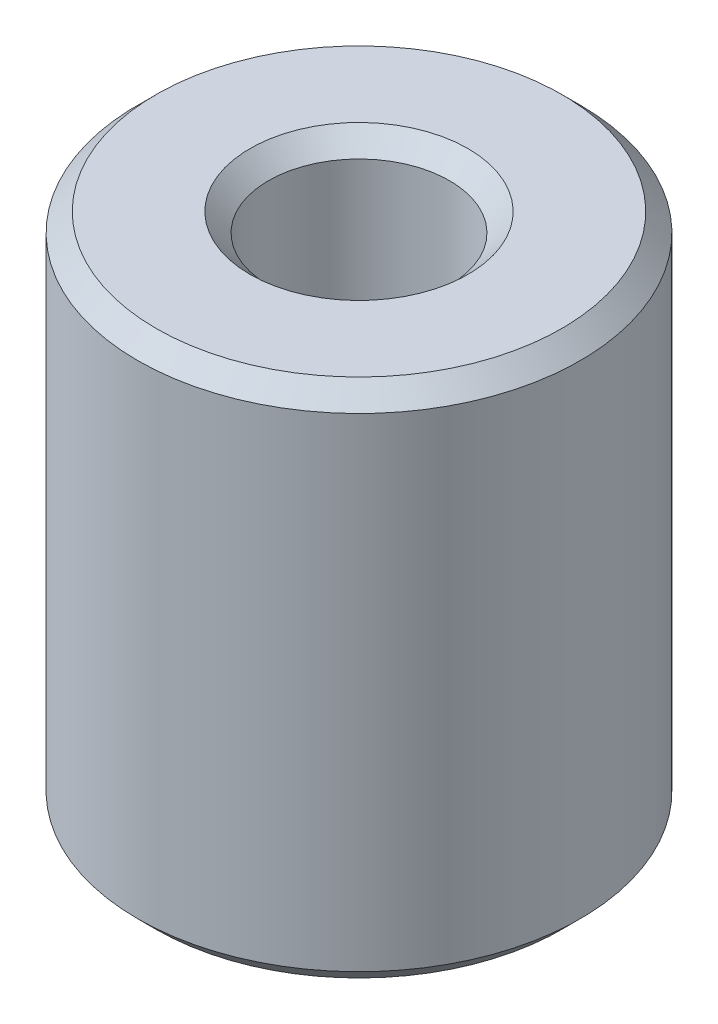
from build123d import *

# Parameters (mm, degrees)
SKETCH1_R           = 37.5
BOSS_EXTRUDE1_DEPTH = 88.202172089
SKETCH2_R           = 15.339657837
CUT_EXTRUDE1_DEPTH  = 103.91804099
CHAMFER1_SIZE       = 3.1371171


with BuildPart() as part:
    # Sketch1 → Boss-Extrude1 (new body)
    with BuildSketch(Plane(origin=(0, 0, 0), x_dir=(1, 0, 0), z_dir=(0, 1, 0))):
        Circle(SKETCH1_R)
    extrude(amount=BOSS_EXTRUDE1_DEPTH)

    # Sketch2 → Cut-Extrude1 (cut, through all)
    with BuildSketch(Plane(origin=(0, 0, 0), x_dir=(1, 0, 0), z_dir=(0, 1, 0))):
        Circle(SKETCH2_R)
    extrude(amount=CUT_EXTRUDE1_DEPTH, mode=Mode.SUBTRACT)

    # Chamfer1
    chamfer1_edges = [part.edges().sort_by_distance(p)[0] for p in [
        (-15.339657837, 88.202172089, 0),
        (-15.339657837, 0, 0),
        (-37.5, 0, 0),
        (-37.5, 88.202172089, 0),
    ]]
    chamfer(chamfer1_edges, length=CHAMFER1_SIZE)


solid = part.part
